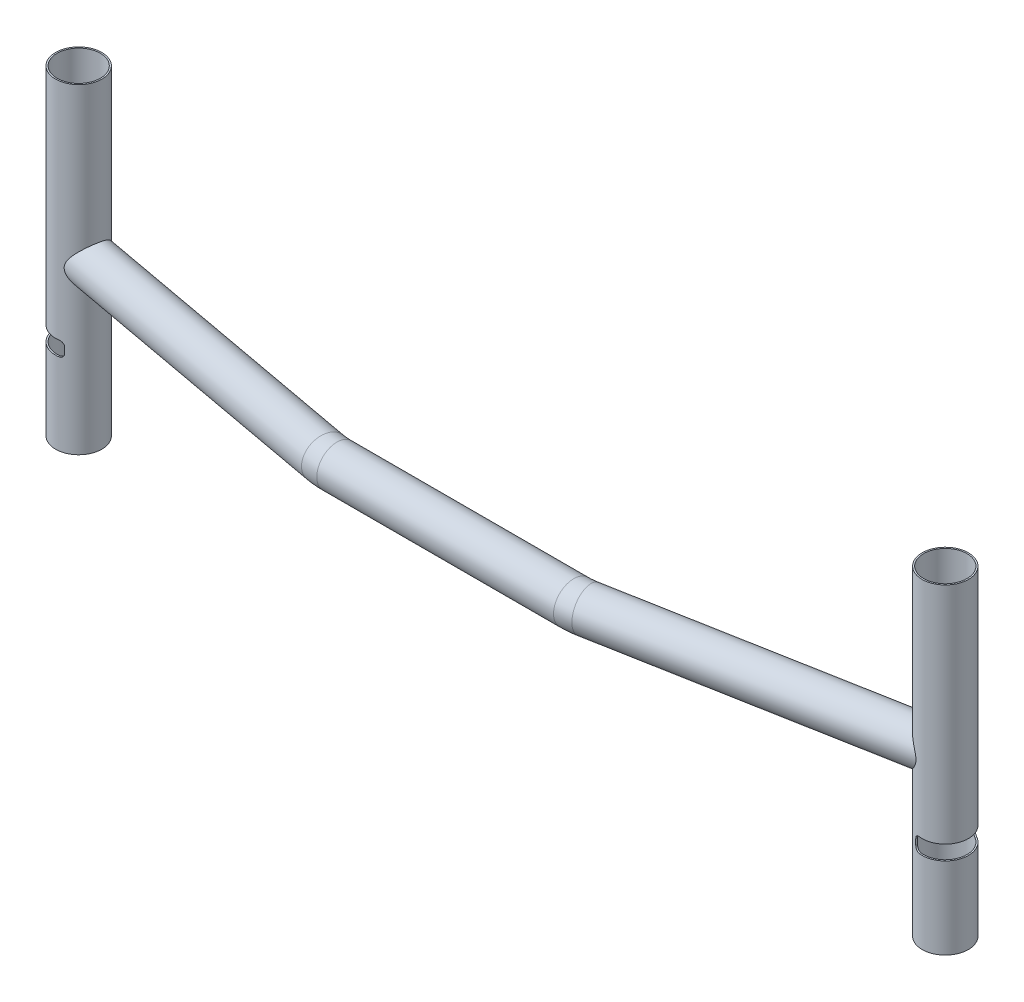
from build123d import *

# Parameters (mm, degrees)
SKETCH2_R           = 11.1
SKETCH2_R_2         = 10.3
SKETCH3_R           = 12.7
SKETCH3_R_2         = 11.9
BOSS_EXTRUDE1_DEPTH = 88
SKETCH4_R           = 11.9
CUT_EXTRUDE1_DEPTH  = 310.344523999
SKETCH5_R           = 10.7
CUT_EXTRUDE2_DEPTH  = 88
CUT_EXTRUDE3_DEPTH  = 20
CUT_EXTRUDE4_REACH  = 271.188
SKETCH8_R           = 3
CUT_EXTRUDE6_REACH  = 274.54
SKETCH11_W          = 4
SKETCH11_H          = 12


with BuildPart() as part:
    # Sweep1: sweep along a path in Sketch1
    with BuildLine(Plane(origin=(0, 0, 0), x_dir=(1, 0, 0), z_dir=(0, 1, 0))) as sweep1_path:
        Line((232, 30), (72.22502534, 0.657923176))
        ThreePointArc((72.22502534, 0.657923176), (68.627459651, 0.164820366), (65, 0))
        Line((65, 0), (-65, 0))
        ThreePointArc((-65, 0), (-68.627459651, 0.164820366), (-72.22502534, 0.657923176))
        Line((-72.22502534, 0.657923176), (-232, 30))
    # Sketch2 → Sweep1 (sweep)
    with BuildSketch(Plane(origin=(232, 0, -30), x_dir=(-0.18062563349676417, 0, -0.9835519206040384), z_dir=(0.9835519206040384, 0, -0.18062563349676417))):
        Circle(SKETCH2_R)
        Circle(SKETCH2_R_2, mode=Mode.SUBTRACT)
    sweep(path=sweep1_path.line)

    # Sketch3 → Boss-Extrude1 (add, symmetric)
    with BuildSketch(Plane(origin=(0, 0, 0), x_dir=(1, 0, 0), z_dir=(0, 1, 0))):
        with Locations((237.901311524, 31.083753801)):
            Circle(SKETCH3_R)
        with Locations((237.901311524, 31.083753801)):
            Circle(SKETCH3_R_2, mode=Mode.SUBTRACT)
    boss_extrude1 = extrude(amount=BOSS_EXTRUDE1_DEPTH, both=True)

    # Sketch4 → Cut-Extrude1 (cut, through all)
    with BuildSketch(Plane.XZ.offset(88)):
        with Locations((237.901311524, -31.083753801)):
            Circle(SKETCH4_R)
    cut_extrude1 = extrude(amount=-CUT_EXTRUDE1_DEPTH, mode=Mode.SUBTRACT)

    # Sketch5 → Cut-Extrude2 (cut)
    with BuildSketch(Plane(origin=(232, 0, -30), x_dir=(-0.18062563349676417, 0, -0.9835519206040384), z_dir=(0.9835519206040384, 0, -0.18062563349676417))):
        with Locations((-0.014888445, 0)):
            Circle(SKETCH5_R)
    cut_extrude2 = extrude(amount=-CUT_EXTRUDE2_DEPTH, mode=Mode.SUBTRACT)

    # Sketch7 → Cut-Extrude3 (cut, symmetric)
    with BuildSketch(Plane(origin=(237.901311524, 88, -31.083753801), x_dir=(-0.9420937659324533, 0, -0.3353495731191677), z_dir=(0.33534957311916763, 0, -0.9420937659324532))):
        with BuildLine():
            Line((-2.5, -123.230571249), (-12.7, -123.230571249))
            Line((-12.7, -123.230571249), (-12.7, -131.230571249))
            Line((-12.7, -131.230571249), (-2.5, -131.230571249))
            ThreePointArc((-2.5, -131.230571249), (-0.732233047, -130.498338202), (0, -128.730571249))
            Line((0, -128.730571249), (0, -125.730571249))
            ThreePointArc((0, -125.730571249), (-0.732233047, -123.962804296), (-2.5, -123.230571249))
        make_face()
    cut_extrude3 = extrude(amount=CUT_EXTRUDE3_DEPTH, both=True, mode=Mode.SUBTRACT)

    # Mirror1: Boss-Extrude1, Cut-Extrude1, Cut-Extrude2, Cut-Extrude3 across plane
    add(boss_extrude1.mirror(Plane(origin=(0, 0, 0), x_dir=(0, 0, 1), z_dir=(1, 0, 0))))
    add(cut_extrude1.mirror(Plane(origin=(0, 0, 0), x_dir=(0, 0, 1), z_dir=(1, 0, 0))), mode=Mode.SUBTRACT)
    add(cut_extrude2.mirror(Plane(origin=(0, 0, 0), x_dir=(0, 0, 1), z_dir=(1, 0, 0))), mode=Mode.SUBTRACT)
    add(cut_extrude3.mirror(Plane(origin=(0, 0, 0), x_dir=(0, 0, 1), z_dir=(1, 0, 0))), mode=Mode.SUBTRACT)

    # Sketch8 → Cut-Extrude4 (cut, up to next)
    with BuildSketch(Plane(origin=(0, 0, 0), x_dir=(1, 0, 0), z_dir=(0, 1, 0)), mode=Mode.PRIVATE) as cut_extrude4_sk1:
        with Locations((216.987516382, 26.593661315)):
            Circle(SKETCH8_R)
    cut_extrude4_tool1 = extrude(cut_extrude4_sk1.sketch, amount=-CUT_EXTRUDE4_REACH, mode=Mode.PRIVATE) & part.part
    add(cut_extrude4_tool1.solids().sort_by_distance((216.987516, 0, -26.593661))[0], mode=Mode.SUBTRACT)

    # Sketch11 → Cut-Extrude6 (cut, up to next)
    with BuildSketch(Plane.XY.offset(-50), mode=Mode.PRIVATE) as cut_extrude6_sk1:
        with Locations((237.901311524, -88)):
            Rectangle(SKETCH11_W, SKETCH11_H)
    cut_extrude6_tool1 = extrude(cut_extrude6_sk1.sketch, amount=CUT_EXTRUDE6_REACH, mode=Mode.PRIVATE) & part.part
    cut_extrude6 = cut_extrude6_tool1.solids().sort_by_distance((237.901312, -88, -50))[0]
    add(cut_extrude6, mode=Mode.SUBTRACT)

    # Mirror2: Cut-Extrude6 across plane
    add(cut_extrude6.mirror(Plane(origin=(0, 0, 0), x_dir=(0, 0, 1), z_dir=(1, 0, 0))), mode=Mode.SUBTRACT)


solid = part.part
